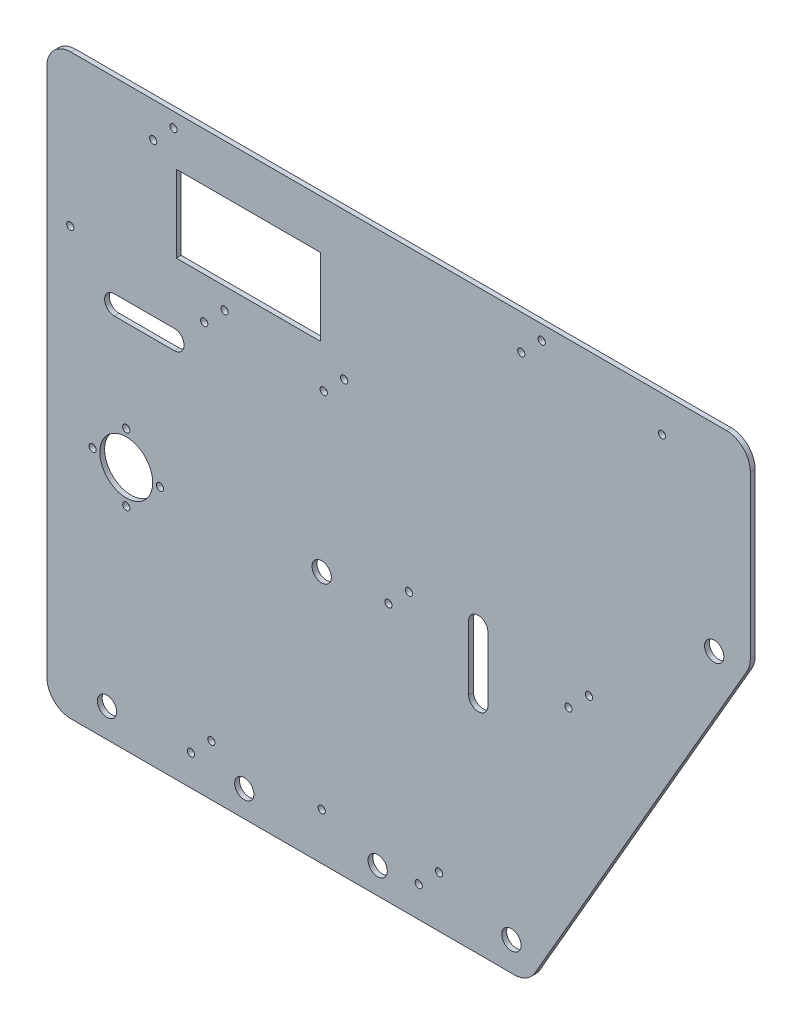
from build123d import *

# Parameters (mm, degrees)
BOSS_EXTRUDE1_DEPTH = 2
SKETCH2_R           = 4
SKETCH2_R_2         = 11
SKETCH2_R_3         = 1.5
CUT_EXTRUDE1_DEPTH  = 3
SKETCH4_W           = 292.37604307
SKETCH4_H           = 50
BOSS_EXTRUDE2_DEPTH = 2
FILLET1_R           = 10
SKETCH5_R           = 1.5
SKETCH5_W           = 60
SKETCH5_H           = 32
CUT_EXTRUDE2_DEPTH  = 11


with BuildPart() as part:
    # Sketch1 → Boss-Extrude1 (new body)
    with BuildSketch(Plane.XY):
        Polygon((-100, 110), (-100, -80), (100, -80), (192.37604307, 80), (192.37604307, 110), align=None)
    extrude(amount=BOSS_EXTRUDE1_DEPTH)

    # Sketch2 → Cut-Extrude1 (cut)
    with BuildSketch(Plane.XY.offset(2)):
        with Locations((93.07179677, -68)):
            Circle(SKETCH2_R)
        with Locations((177.364936071, 78)):
            Circle(SKETCH2_R)
        with Locations((-67, 22)):
            Circle(SKETCH2_R_2)
        with Locations((-75, -68)):
            Circle(SKETCH2_R)
        with Locations((-53, 22)):
            Circle(SKETCH2_R_3)
        with Locations((-67, 36)):
            Circle(SKETCH2_R_3)
        with Locations((-81, 22)):
            Circle(SKETCH2_R_3)
        with Locations((-67, 8)):
            Circle(SKETCH2_R_3)
        with Locations((54.54952947, -67.242640687)):
            Circle(SKETCH2_R_3)
        with Locations((63.034810844, -58.757359313)):
            Circle(SKETCH2_R_3)
        with Locations((14.225855729, -60.5)):
            Circle(SKETCH2_R_3)
        with Locations((-40.127135228, -67.242640687)):
            Circle(SKETCH2_R_3)
        with Locations((-31.641853854, -58.757359313)):
            Circle(SKETCH2_R_3)
        with Locations((-90.295627115, 97.216930167)):
            Circle(SKETCH2_R_3)
        with Locations((-34.605070088, 90.47428948)):
            Circle(SKETCH2_R_3)
        with Locations((-26.119788714, 98.959570854)):
            Circle(SKETCH2_R_3)
        with Locations((15.078196993, 90.47428948)):
            Circle(SKETCH2_R_3)
        with Locations((23.563478368, 98.959570854)):
            Circle(SKETCH2_R_3)
        with Locations((41.969500075, 27.47428948)):
            Circle(SKETCH2_R_3)
        with Locations((50.454781449, 35.959570854)):
            Circle(SKETCH2_R_3)
        with Locations((116.811272287, 27.47428948)):
            Circle(SKETCH2_R_3)
        with Locations((125.296553661, 35.959570854)):
            Circle(SKETCH2_R_3)
        with Locations((14.225855729, 25)):
            Circle(SKETCH2_R)
        with Locations((155.651799279, 145.145615666)):
            Circle(SKETCH2_R_3)
        with Locations((-55.814717647, 145.47428948)):
            Circle(SKETCH2_R_3)
        with Locations((-47.329436273, 153.959570854)):
            Circle(SKETCH2_R_3)
        with Locations((97.192431756, 145.47428948)):
            Circle(SKETCH2_R_3)
        with Locations((105.67771313, 153.959570854)):
            Circle(SKETCH2_R_3)
        with Locations((-17.947932492, -69.117445741)):
            Circle(SKETCH2_R)
        with Locations((37.494421294, -69.117445741)):
            Circle(SKETCH2_R)
        with BuildLine():
            Line((75.290389443, 11.241781095), (75.290389443, 37.908558601))
            ThreePointArc((75.290389443, 37.908558601), (79.290389443, 41.908558601), (83.290389443, 37.908558601))
            Line((83.290389443, 37.908558601), (83.290389443, 11.241781095))
            ThreePointArc((83.290389443, 11.241781095), (79.290389443, 7.241781095), (75.290389443, 11.241781095))
        make_face()
        with BuildLine():
            Line((-72, 82), (-47, 82))
            ThreePointArc((-47, 82), (-43, 78), (-47, 74))
            Line((-47, 74), (-72, 74))
            ThreePointArc((-72, 74), (-76, 78), (-72, 82))
        make_face()
    extrude(amount=-CUT_EXTRUDE1_DEPTH, mode=Mode.SUBTRACT)

    # Sketch4 → Boss-Extrude2 (add)
    with BuildSketch(Plane.XY.offset(2)):
        with Locations((46.188021535, 135)):
            Rectangle(SKETCH4_W, SKETCH4_H)
    extrude(amount=-BOSS_EXTRUDE2_DEPTH)

    # Fillet1
    fillet1_edges = [part.edges().sort_by_distance(p)[0] for p in [
        (192.37604307, 160, 1),
        (192.37604307, 80, 1),
        (100, -80, 1),
        (-100, -80, 1),
        (-100, 160, 1),
    ]]
    fillet(fillet1_edges, radius=FILLET1_R)

    # Sketch5 → Cut-Extrude2 (cut)
    with BuildSketch(Plane.XY.offset(2)):
        with Locations((-55.814717647, 145.47428948)):
            Circle(SKETCH5_R)
        with Locations((-47.329436273, 153.959570854)):
            Circle(SKETCH5_R)
        with Locations((97.192431756, 145.47428948)):
            Circle(SKETCH5_R)
        with Locations((105.67771313, 153.959570854)):
            Circle(SKETCH5_R)
        with Locations((155.651799279, 145.145615666)):
            Circle(SKETCH5_R)
        with Locations((-16.178132997, 123.716930167)):
            Rectangle(SKETCH5_W, SKETCH5_H)
    extrude(amount=-CUT_EXTRUDE2_DEPTH, mode=Mode.SUBTRACT)


solid = part.part
